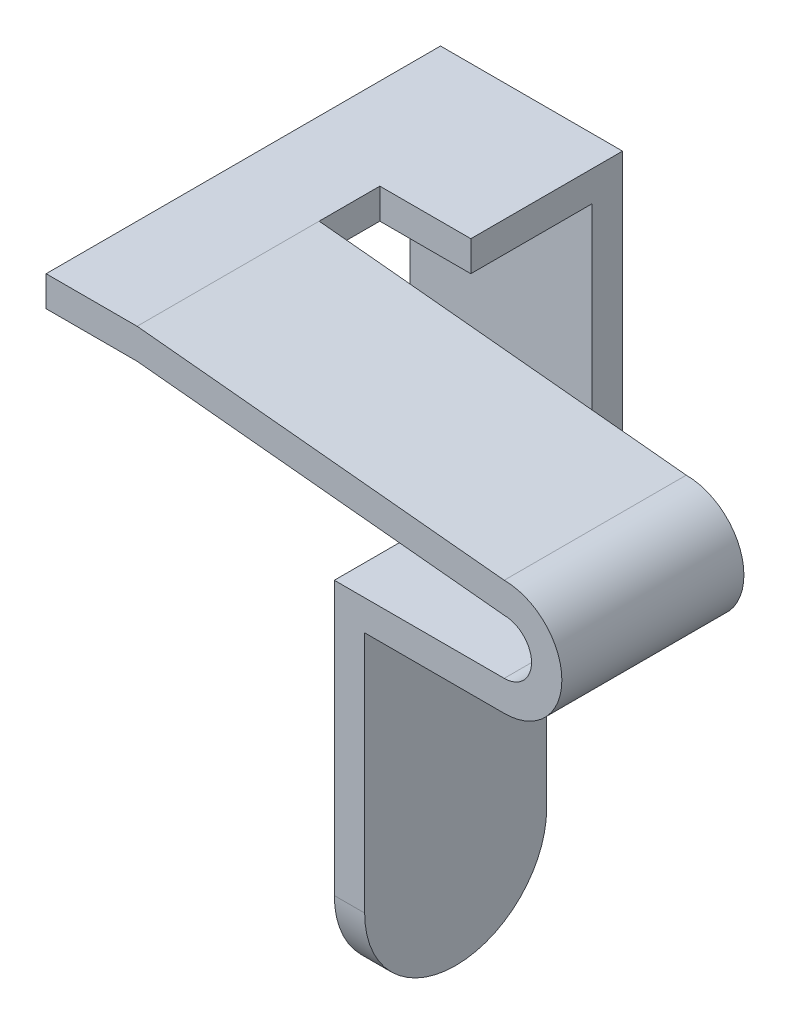
from build123d import *

# Parameters (mm, degrees)
BOSS_EXTRUDE1_DEPTH = 3
BOSS_EXTRUDE3_DEPTH = 0.5
SKETCH4_W           = 3
SKETCH4_H           = 0.5
BOSS_EXTRUDE5_DEPTH = 7.5
FILLET1_R           = 1.5


with BuildPart() as part:
    # Sketch1 → Boss-Extrude1 (new body)
    with BuildSketch(Plane.XY):
        with BuildLine():
            Line((0, 0), (1.5, 0))
            Line((1.5, 0), (7.55, -0.6))
            ThreePointArc((7.55, -0.6), (8, -1.05), (7.55, -1.5))
            Line((7.55, -1.5), (4.75, -1.5))
            Line((4.75, -1.5), (4.75, -7.5))
            Line((4.75, -7.5), (5.25, -7.5))
            Line((5.25, -7.5), (5.25, -2))
            Line((5.25, -2), (7.55, -2))
            ThreePointArc((7.55, -2), (8.5, -1.05), (7.55, -0.1))
            Line((7.55, -0.1), (1.5, 0.5))
            Line((1.5, 0.5), (0, 0.5))
            Line((0, 0.5), (0, 0))
        make_face()
    extrude(amount=BOSS_EXTRUDE1_DEPTH)

    # Sketch3 → Boss-Extrude3 (add)
    with BuildSketch(Plane(origin=(0, 0, 0), x_dir=(-1, 0, 0), z_dir=(0, -1, 0))):
        Polygon((-3, 1), (-1.5, 1), (-1.5, 0), (0, 0), (0, 3.5), (-3, 3.5), align=None)
    extrude(amount=-BOSS_EXTRUDE3_DEPTH)

    # Sketch4 → Boss-Extrude5 (add)
    with BuildSketch(Plane.XZ):
        with Locations((1.5, -3.25)):
            Rectangle(SKETCH4_W, SKETCH4_H)
    extrude(amount=BOSS_EXTRUDE5_DEPTH)

    # Fillet1
    fillet1_edges = [part.edges().sort_by_distance(p)[0] for p in [
        (0, -7.5, -3.25),
        (3, -7.5, -3.25),
        (5, -7.5, 3),
        (5, -7.5, 0),
    ]]
    fillet(fillet1_edges, radius=FILLET1_R - 0.0001)  # a hair under: the kernel refuses the full size


solid = part.part
